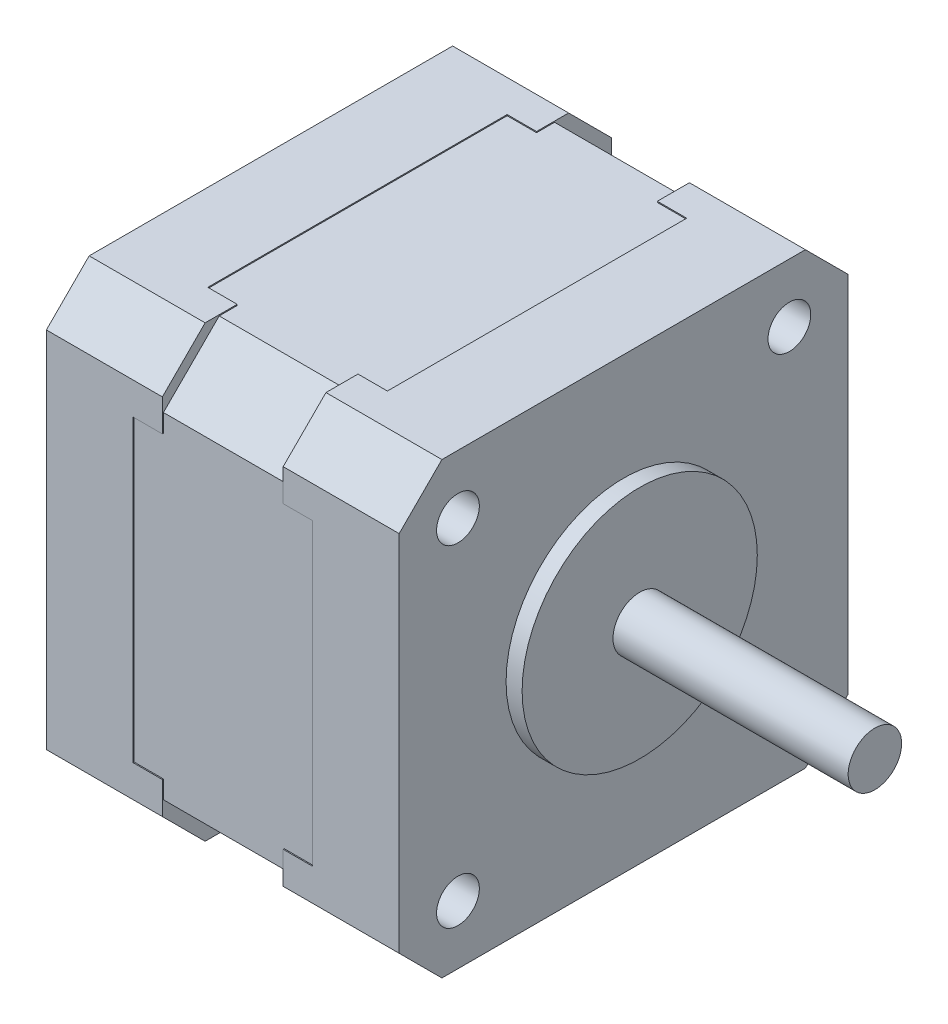
from build123d import *

# Parameters (mm, degrees)
CROQUIS1_W                  = 41.8
CROQUIS1_H                  = 41.8
SALIENTE_EXTRUIR1_DEPTH     = 11.3
CROQUIS2_W                  = 42
CROQUIS2_H                  = 41.9
SALIENTE_EXTRUIR2_DEPTH     = 10.85
CROQUIS3_W                  = 10.85
CROQUIS3_H                  = 42
SALIENTE_EXTRUIR3_DEPTH     = 0.1
CROQUIS4_W                  = 42
CROQUIS4_H                  = 42
SALIENTE_EXTRUIR4_DEPTH     = 10.85
CORTAR_EXTRUIR1_REACH       = 40.756
CROQUIS5_W                  = 0.1
CROQUIS5_H                  = 28
CORTAR_EXTRUIR2_REACH       = 40.756
CROQUIS6_W                  = 28
CROQUIS6_H                  = 0.1
CROQUIS7_W                  = 2.75
CROQUIS7_H                  = 28
CORTAR_EXTRUIR3_DEPTH       = 0.1
CROQUIS8_W                  = 2.75
CROQUIS8_H                  = 28
CORTAR_EXTRUIR4_DEPTH       = 0.1
CROQUIS9_W                  = 28
CROQUIS9_H                  = 0.1
CORTAR_EXTRUIR5_DEPTH       = 2.75
CROQUIS10_W                 = 2.75
CROQUIS10_H                 = 28
CORTAR_EXTRUIR6_DEPTH       = 0.1
CROQUIS11_W                 = 2.75
CROQUIS11_H                 = 28
CORTAR_EXTRUIR7_DEPTH       = 0.1
CROQUIS12_W                 = 2.75
CROQUIS12_H                 = 28
CORTAR_EXTRUIR8_DEPTH       = 0.1
CHAFL_N1_SIZE               = 5.214213562
CHAFL_N2_SIZE               = 4
CORTAR_EXTRUIR10_DEPTH      = 6
CORTAR_EXTRUIR10_DEPTH_BACK = 3
CROQUIS18_R                 = 2


with BuildPart() as part:
    # Croquis1 → Saliente-Extruir1 (new body)
    with BuildSketch(Plane(origin=(-5.65, 0, 0), x_dir=(0, -1, 0), z_dir=(-1, 0, 0))):
        Rectangle(CROQUIS1_W, CROQUIS1_H)
    extrude(amount=-SALIENTE_EXTRUIR1_DEPTH)

    # Croquis2 → Saliente-Extruir2 (add)
    with BuildSketch(Plane(origin=(5.65, 0, 0), x_dir=(0, 0, -1), z_dir=(1, 0, 0))):
        with Locations((0, -0.05)):
            Rectangle(CROQUIS2_W, CROQUIS2_H)
    extrude(amount=SALIENTE_EXTRUIR2_DEPTH)

    # Croquis3 → Saliente-Extruir3 (add)
    with BuildSketch(Plane(origin=(0, 20.9, 0), x_dir=(-1, 0, 0), z_dir=(0, 1, 0))):
        with Locations((-11.075, 0)):
            Rectangle(CROQUIS3_W, CROQUIS3_H)
    extrude(amount=SALIENTE_EXTRUIR3_DEPTH)

    # Croquis4 → Saliente-Extruir4 (add)
    with BuildSketch(Plane(origin=(-5.65, 0, 0), x_dir=(0, 0, -1), z_dir=(1, 0, 0))):
        Rectangle(CROQUIS4_W, CROQUIS4_H)
    extrude(amount=-SALIENTE_EXTRUIR4_DEPTH)

    # Croquis5 → Cortar-Extruir1 (cut, up to next)
    with BuildSketch(Plane(origin=(8.4, 0, 0), x_dir=(0, 0, -1), z_dir=(1, 0, 0)), mode=Mode.PRIVATE) as cortar_extruir1_sk1:
        with Locations((20.95, 0)):
            Rectangle(CROQUIS5_W, CROQUIS5_H)
    cortar_extruir1_tool1 = extrude(cortar_extruir1_sk1.sketch, amount=-CORTAR_EXTRUIR1_REACH, mode=Mode.PRIVATE) & part.part
    add(cortar_extruir1_tool1.solids().sort_by_distance((8.4, 0, -20.95))[0], mode=Mode.SUBTRACT)

    # Croquis6 → Cortar-Extruir2 (cut, up to next)
    with BuildSketch(Plane(origin=(-8.4, 0, 0), x_dir=(0, -1, 0), z_dir=(-1, 0, 0)), mode=Mode.PRIVATE) as cortar_extruir2_sk1:
        with Locations((0, 20.95)):
            Rectangle(CROQUIS6_W, CROQUIS6_H)
    cortar_extruir2_tool1 = extrude(cortar_extruir2_sk1.sketch, amount=-CORTAR_EXTRUIR2_REACH, mode=Mode.PRIVATE) & part.part
    add(cortar_extruir2_tool1.solids().sort_by_distance((-8.4, 0, 20.95))[0], mode=Mode.SUBTRACT)

    # Croquis7 → Cortar-Extruir3 (cut)
    with BuildSketch(Plane.XZ.offset(21)):
        with Locations((7.025, 0)):
            Rectangle(CROQUIS7_W, CROQUIS7_H)
    extrude(amount=-CORTAR_EXTRUIR3_DEPTH, mode=Mode.SUBTRACT)

    # Croquis8 → Cortar-Extruir4 (cut)
    with BuildSketch(Plane.XY.offset(21)):
        with Locations((7.025, 0)):
            Rectangle(CROQUIS8_W, CROQUIS8_H)
    extrude(amount=-CORTAR_EXTRUIR4_DEPTH, mode=Mode.SUBTRACT)

    # Croquis9 → Cortar-Extruir5 (cut)
    with BuildSketch(Plane.ZY.offset(-5.65)):
        with Locations((0, 20.95)):
            Rectangle(CROQUIS9_W, CROQUIS9_H)
    extrude(amount=-CORTAR_EXTRUIR5_DEPTH, mode=Mode.SUBTRACT)

    # Croquis10 → Cortar-Extruir6 (cut)
    with BuildSketch(Plane.XZ.offset(21)):
        with Locations((-7.025, 0)):
            Rectangle(CROQUIS10_W, CROQUIS10_H)
    extrude(amount=-CORTAR_EXTRUIR6_DEPTH, mode=Mode.SUBTRACT)

    # Croquis11 → Cortar-Extruir7 (cut)
    with BuildSketch(Plane(origin=(0, 0, -21), x_dir=(-1, 0, 0), z_dir=(0, 0, -1))):
        with Locations((7.025, 0)):
            Rectangle(CROQUIS11_W, CROQUIS11_H)
    extrude(amount=-CORTAR_EXTRUIR7_DEPTH, mode=Mode.SUBTRACT)

    # Croquis12 → Cortar-Extruir8 (cut)
    with BuildSketch(Plane(origin=(0, 21, 0), x_dir=(-1, 0, 0), z_dir=(0, 1, 0))):
        with Locations((7.025, 0)):
            Rectangle(CROQUIS12_W, CROQUIS12_H)
    extrude(amount=-CORTAR_EXTRUIR8_DEPTH, mode=Mode.SUBTRACT)

    # Croquis15 → Revolución1 (revolve)
    with BuildSketch(Plane.XY):
        Polygon((15.5, 11), (15.5, 0), (40, 0), (40, 2.5), (18, 2.5), (18, 11), align=None)
    revolve(axis=Axis((15.5, 0, 0), (1, 0, 0)))

    # Chaflán1
    chafl_n1_edges = [part.edges().sort_by_distance(p)[0] for p in [
        (0, -20.9, -20.9),
        (0, 20.9, 20.9),
        (0, 20.9, -20.9),
        (0, -20.9, 20.9),
    ]]
    chamfer(chafl_n1_edges, length=CHAFL_N1_SIZE)

    # Chaflán2
    chafl_n2_edges = [part.edges().sort_by_distance(p)[0] for p in [
        (-11.075, 21, -21),
        (-11.075, -21, 21),
        (11.075, -21, -21),
        (11.075, 21, -21),
        (-11.075, 21, 21),
        (11.075, 21, 21),
        (-11.075, -21, -21),
        (11.075, -21, 21),
    ]]
    chamfer(chafl_n2_edges, length=CHAFL_N2_SIZE)

    # Croquis18 → Cortar-Extruir10 (cut, two sides: drawn at the far end of the back side and taken through both)
    with BuildSketch(Plane(origin=(12.45, 0, 0), x_dir=(0, 0, -1), z_dir=(1, 0, 0)).offset(-CORTAR_EXTRUIR10_DEPTH_BACK)):
        with Locations((-15.5, 15.5)):
            Circle(CROQUIS18_R)
        with Locations((15.5, 15.5)):
            Circle(CROQUIS18_R)
        with Locations((15.5, -15.5)):
            Circle(CROQUIS18_R)
        with Locations((-15.5, -15.5)):
            Circle(CROQUIS18_R)
    extrude(amount=CORTAR_EXTRUIR10_DEPTH + CORTAR_EXTRUIR10_DEPTH_BACK, mode=Mode.SUBTRACT)


solid = part.part
